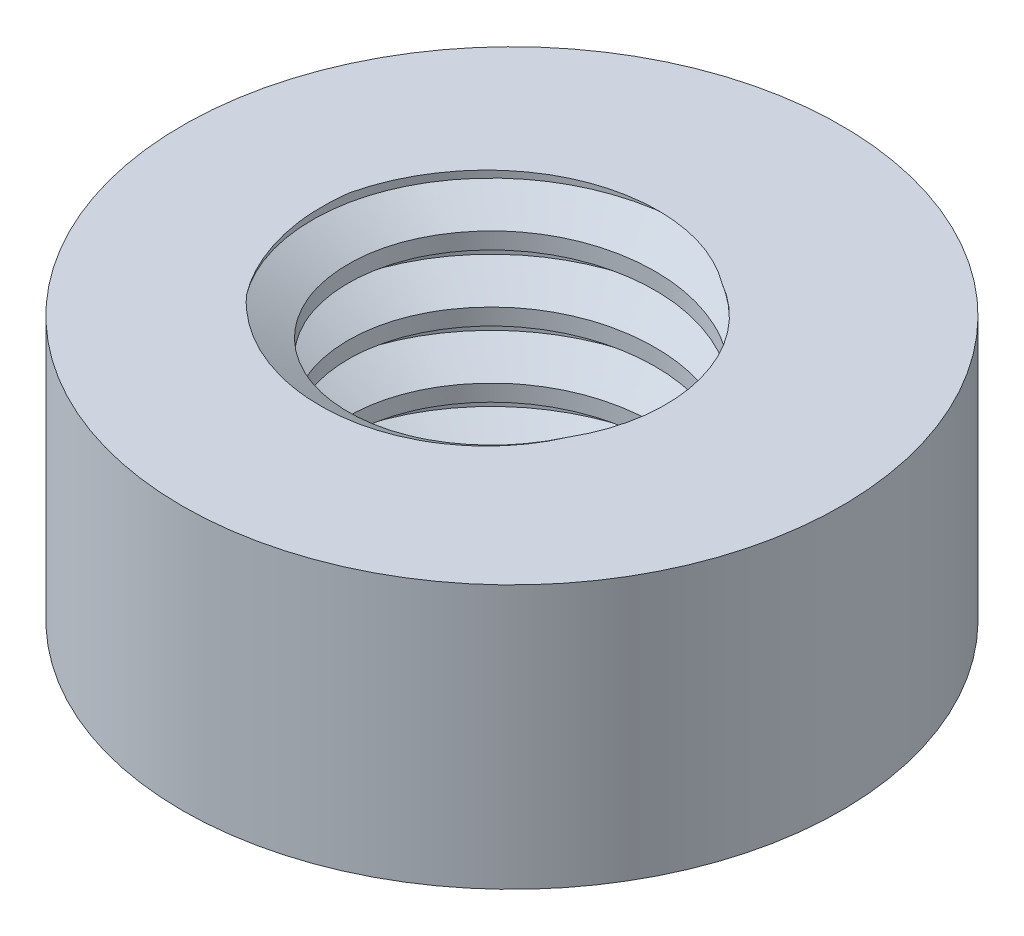
from build123d import *

# Parameters (mm, degrees)
SKETCH1_R           = 7.5
SKETCH1_R_2         = 3.5
BOSS_EXTRUDE1_DEPTH = 6
THREAD1_PITCH       = 1.5


with BuildPart() as part:
    # Sketch1 → Boss-Extrude1 (new body)
    with BuildSketch(Plane(origin=(0, 0, 0), x_dir=(1, 0, 0), z_dir=(0, 1, 0))):
        with Locations(Location((0, 0, 0), (0, 0, 270))):
            Circle(SKETCH1_R)
        with Locations(Location((0, 0, 0), (0, 0, 270))):
            Circle(SKETCH1_R_2, mode=Mode.SUBTRACT)
    extrude(amount=BOSS_EXTRUDE1_DEPTH)

    # Thread1: the profile of Thread Profile2 profile screwed along a right-hand helix of 5.333333 turns, 8 arcs to a turn; built about Z, then put on its axis
    thread1_z = Axis((0, 0, 0), (0, 0, 1))
    thread1_corners = [(3.4997, 0, -0.000173205), (4.311898812, 0, 0.468749998), (4.311898812, 0, 0.656249998), (3.4997, 0, 1.125173201)]
    with BuildLine(mode=Mode.PRIVATE) as thread1_profile:
        Line(thread1_corners[0], thread1_corners[1])
        Line(thread1_corners[1], thread1_corners[2])
        Line(thread1_corners[2], thread1_corners[3])
        Line(thread1_corners[3], thread1_corners[0])
    thread1_cap = Face(thread1_profile.wire())
    thread1_turn_angles = [0, 22.5, 45, 67.5, 90, 112.5, 135, 157.5, 180, 202.5, 225, 247.5, 270, 292.5, 315, 337.5, 360]
    thread1_turn_weights = [1, 0.9238795325112867, 1, 0.9238795325112867, 1, 0.9238795325112867, 1, 0.9238795325112867, 1, 0.9238795325112867, 1, 0.9238795325112867, 1, 0.9238795325112867, 1, 0.9238795325112867, 1]
    thread1_turn_rails = [Edge.make_bspline([Vector(p[0], p[1], 0).rotate(thread1_z, thread1_turn_angles[k]) / thread1_turn_weights[k] + Vector(0, 0, p[2] + THREAD1_PITCH * thread1_turn_angles[k] / 360) for k in range(17)], [0, 0, 0, 1, 1, 2, 2, 3, 3, 4, 4, 5, 5, 6, 6, 7, 7, 8, 8, 8], 2, thread1_turn_weights) for p in thread1_corners]
    thread1_turn_sides = [Face.make_surface_from_curves(thread1_turn_rails[p[0]], thread1_turn_rails[p[1]]) for p in [(0, 1), (1, 2), (2, 3), (3, 0)]]
    thread1_last_angles = [1800, 1822.5, 1845, 1867.5, 1890, 1905, 1920]
    thread1_last_weights = [1, 0.9238795325112867, 1, 0.9238795325112867, 1, 0.9659258262890688, 1]
    thread1_last_rails = [Edge.make_bspline([Vector(p[0], p[1], 0).rotate(thread1_z, thread1_last_angles[k]) / thread1_last_weights[k] + Vector(0, 0, p[2] + THREAD1_PITCH * thread1_last_angles[k] / 360) for k in range(7)], [0, 0, 0, 1, 1, 2, 2, 3, 3, 3], 2, thread1_last_weights) for p in thread1_corners]
    thread1_last_sides = [Face.make_surface_from_curves(thread1_last_rails[p[0]], thread1_last_rails[p[1]]) for p in [(0, 1), (1, 2), (2, 3), (3, 0)]]
    thread1 = Plane(origin=(0, 8, 0), x_dir=(-1, 0, 0), z_dir=(0, -1, 0)) * Solid(Shell([*[p.moved(Location((0, 0, THREAD1_PITCH * i))) for i in range(5) for p in thread1_turn_sides], *thread1_last_sides, thread1_cap, thread1_cap.rotate(thread1_z, 1920).moved(Location((0, 0, THREAD1_PITCH * 1920 / 360)))]))
    add(thread1, mode=Mode.SUBTRACT)


solid = part.part
